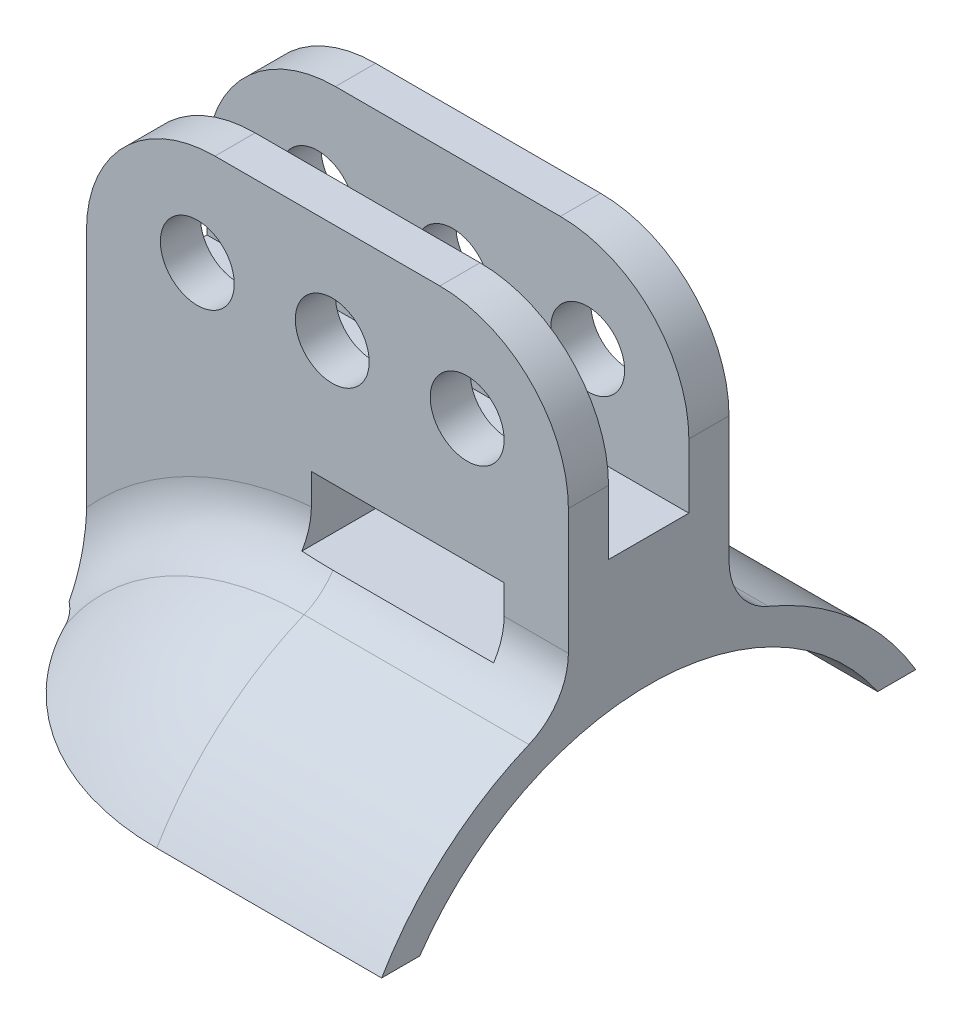
from build123d import *

# Parameters (mm, degrees)
SKETCH2_R                            = 12.2555
SKETCH2_R_2                          = 10.9855
BOSS_EXTRUDE2_DEPTH                  = 15.24
CUT_EXTRUDE1_DEPTH                   = 24.079258231
CUT_EXTRUDE1_DEPTH_BACK              = 24.079258231
SKETCH4_W                            = 6.35
SKETCH4_H                            = 24.511
SKETCH6_W                            = 19.05
SKETCH6_H                            = 6.35
BOSS_EXTRUDE3_DEPTH                  = 11.43
BOSS_EXTRUDE3_DIRECTION_2_REACH      = 32.02
BOSS_EXTRUDE3_DIRECTION_2_END_RADIUS = 12.2555
SKETCH7_R                            = 1.4605
CUT_EXTRUDE3_DEPTH                   = 31.810720874
BOSS_EXTRUDE5_REACH                  = 32.02
BOSS_EXTRUDE5_END_RADIUS             = 12.2555
SKETCH10_W                           = 10.16
SKETCH10_H                           = 6.35
LPATTERN1_COUNT                      = 3
LPATTERN1_PITCH                      = 5.334
SKETCH8_W                            = 3.175
SKETCH8_H                            = 7.62
CUT_EXTRUDE4_DEPTH                   = 35.034282139
FILLET5_R                            = 5.08
FILLET6_R                            = 2.54
BOSS_EXTRUDE6_REACH                  = 36.034
CUT_EXTRUDE5_DEPTH                   = 31.81072095
CUT_EXTRUDE5_DEPTH_BACK              = 31.81072095
SKETCH13_W                           = 7.62
SKETCH13_H                           = 2.54
CUT_EXTRUDE6_DEPTH                   = 31.81072095
CUT_EXTRUDE6_DEPTH_BACK              = 31.81072095
SKETCH14_W                           = 21.1455
SKETCH14_H                           = 18.479818705


with BuildPart() as part:
    # Sketch2 → Boss-Extrude2 (new body)
    with BuildSketch(Plane(origin=(0, 0, 0), x_dir=(0, 0, -1), z_dir=(1, 0, 0))):
        Circle(SKETCH2_R)
        Circle(SKETCH2_R_2, mode=Mode.SUBTRACT)
    extrude(amount=BOSS_EXTRUDE2_DEPTH)

    # Sketch3 → Revolve1 (revolve)
    with BuildSketch(Plane(origin=(0, 0, 0), x_dir=(1, 0, 0), z_dir=(0, 1, 0))):
        with BuildLine():
            Line((-12.2555, 0), (-10.9855, 0))
            ThreePointArc((-10.9855, 0), (-7.767921545, 7.767921545), (0, 10.9855))
            Line((0, 10.9855), (0, 12.2555))
            ThreePointArc((0, 12.2555), (-8.665947157, 8.665947157), (-12.2555, 0))
        make_face()
    revolve(axis=Axis((0, 0, 0), (-1, 0, 0)))

    # Sketch4 → Cut-Extrude1 (cut, two sides: drawn at the far end of the back side and taken through both)
    with BuildSketch(Plane(origin=(0, 0, 0), x_dir=(1, 0, 0), z_dir=(0, 1, 0)).offset(-CUT_EXTRUDE1_DEPTH_BACK)):
        with Locations((12.065, 0)):
            Rectangle(SKETCH4_W, SKETCH4_H)
    extrude(amount=CUT_EXTRUDE1_DEPTH + CUT_EXTRUDE1_DEPTH_BACK, mode=Mode.SUBTRACT)

    # Sketch6 → Boss-Extrude3 (add)
    with BuildSketch(Plane(origin=(0, 12.2555, 0), x_dir=(1, 0, 0), z_dir=(0, 1, 0))):
        with Locations((-0.635, 0)):
            Rectangle(SKETCH6_W, SKETCH6_H)
    extrude(amount=BOSS_EXTRUDE3_DEPTH)

    # Boss-Extrude3 direction 2: up to this cylinder (the profile starts outside it)
    boss_extrude3_direction_2_end = Plane(origin=(-0.635, 0, 0), z_dir=(-1, 0, 0)) * Cylinder(BOSS_EXTRUDE3_DIRECTION_2_END_RADIUS, 89.551, mode=Mode.PRIVATE)
    # Sketch6 → Boss-Extrude3 direction 2 (add, up to the surface)
    with BuildSketch(Plane(origin=(0, 12.2555, 0), x_dir=(1, 0, 0), z_dir=(0, 1, 0)), mode=Mode.PRIVATE) as boss_extrude3_direction_2_sk1:
        with Locations((-0.635, 0)):
            Rectangle(SKETCH6_W, SKETCH6_H)
    boss_extrude3_direction_2_tool1 = extrude(boss_extrude3_direction_2_sk1.sketch, amount=-BOSS_EXTRUDE3_DIRECTION_2_REACH, mode=Mode.PRIVATE) - boss_extrude3_direction_2_end
    add(boss_extrude3_direction_2_tool1.solids().sort_by_distance((-0.635, 12.2555, 0))[0])
    add(boss_extrude3_direction_2_tool1.solids().sort_by_distance((-0.635, 12.2555, 0))[1])

    # Sketch7 → Cut-Extrude3 (cut, through all)
    with BuildSketch(Plane.XY.offset(3.175)):
        with Locations((4.8895, 19.685)):
            Circle(SKETCH7_R)
    cut_extrude3 = extrude(amount=-CUT_EXTRUDE3_DEPTH, mode=Mode.SUBTRACT)

    # Boss-Extrude5: up to this sphere (the profile starts outside it)
    boss_extrude5_end = Location((0, 0, 0)) * Sphere(BOSS_EXTRUDE5_END_RADIUS, mode=Mode.PRIVATE)
    # Sketch10 → Boss-Extrude5 (add, up to the surface)
    with BuildSketch(Plane(origin=(0, 12.2555, 0), x_dir=(1, 0, 0), z_dir=(0, 1, 0)), mode=Mode.PRIVATE) as boss_extrude5_sk1:
        with Locations((-5.08, 0)):
            Rectangle(SKETCH10_W, SKETCH10_H)
    boss_extrude5_tool1 = extrude(boss_extrude5_sk1.sketch, amount=-BOSS_EXTRUDE5_REACH, mode=Mode.PRIVATE) - boss_extrude5_end
    add(boss_extrude5_tool1.solids().sort_by_distance((-5.08, 12.2555, 0))[0])

    # LPattern1: Cut-Extrude3 ×3
    with Locations(*[(-i * LPATTERN1_PITCH, 0, 0) for i in range(1, LPATTERN1_COUNT)]):
        add(cut_extrude3, mode=Mode.SUBTRACT)

    # Sketch8 → Cut-Extrude4 (cut, through all)
    with BuildSketch(Plane(origin=(8.89, 0, 0), x_dir=(0, 0, -1), z_dir=(1, 0, 0))):
        with Locations((0, 19.8755)):
            Rectangle(SKETCH8_W, SKETCH8_H)
    extrude(amount=-CUT_EXTRUDE4_DEPTH, mode=Mode.SUBTRACT)

    # Fillet5
    fillet5_edges = [part.edges().sort_by_distance(p)[0] for p in [
        (-10.16, 23.6855, -2.38125),
        (8.89, 23.6855, -2.38125),
        (-10.16, 23.6855, 2.38125),
        (8.89, 23.6855, 2.38125),
    ]]
    fillet(fillet5_edges, radius=FILLET5_R)

    # Fillet6
    fillet6_edges = [part.edges().sort_by_distance(p)[0] for p in [
        (4.445, 11.837088124, -3.175),
        (-5.84039985, 10.295940212, 3.175),
        (-10.16, 6.853588859, 0),
        (-5.84039985, 10.295940212, -3.175),
        (4.445, 11.837088124, 3.175),
    ]]
    fillet(fillet6_edges, radius=FILLET6_R)

    # Sketch11 → Boss-Extrude6 (add, up to next)
    with BuildSketch(Plane(origin=(8.89, 0, 0), x_dir=(0, 0, -1), z_dir=(1, 0, 0)), mode=Mode.PRIVATE) as boss_extrude6_sk1:
        with BuildLine():
            Line((5.08, -9.740370129), (-5.08, -9.740370129))
            ThreePointArc((-5.08, -9.740370129), (0, -10.9855), (5.08, -9.740370129))
        make_face()
    boss_extrude6_tool1 = extrude(boss_extrude6_sk1.sketch, amount=-BOSS_EXTRUDE6_REACH, mode=Mode.PRIVATE) - part.part
    add(boss_extrude6_tool1.solids().sort_by_distance((8.89, -10.240924, 0))[0])

    # Sketch13 → Cut-Extrude5 (cut, two sides: drawn at the far end of the back side and taken through both)
    with BuildSketch(Plane.XY.offset(3.175).offset(-CUT_EXTRUDE5_DEPTH_BACK)):
        with Locations((2.54, 13.5255)):
            Rectangle(SKETCH13_W, SKETCH13_H)
    extrude(amount=CUT_EXTRUDE5_DEPTH + CUT_EXTRUDE5_DEPTH_BACK, mode=Mode.SUBTRACT)

    # Sketch14 → Cut-Extrude6 (cut, two sides: drawn at the far end of the back side and taken through both)
    with BuildSketch(Plane.XY.offset(3.175).offset(-CUT_EXTRUDE6_DEPTH_BACK)):
        with Locations((-1.68275, -3.015590648)):
            Rectangle(SKETCH14_W, SKETCH14_H)
    extrude(amount=CUT_EXTRUDE6_DEPTH + CUT_EXTRUDE6_DEPTH_BACK, mode=Mode.SUBTRACT)


solid = part.part
